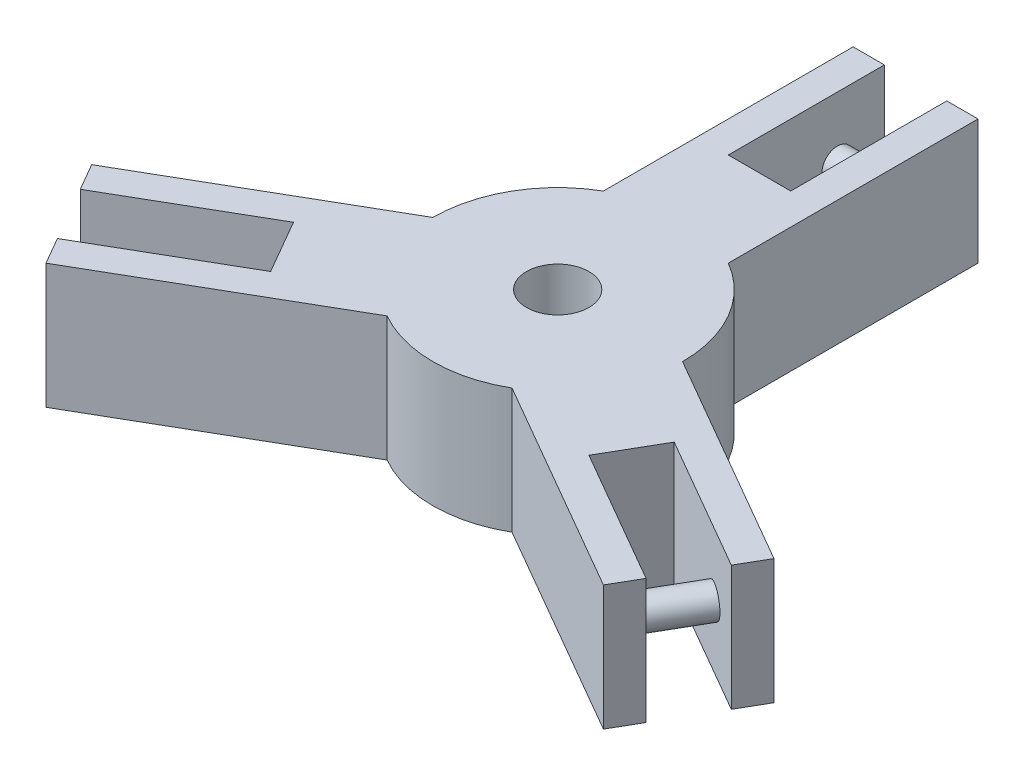
from build123d import *

# Parameters (mm, degrees)
SKETCH1_R           = 10
BOSS_EXTRUDE1_DEPTH = 40
SKETCH2_R           = 5
BOSS_EXTRUDE2_DEPTH = 25
CIRPATTERN1_COUNT   = 3


with BuildPart() as part:
    # Sketch1 → Boss-Extrude1 (new body)
    with BuildSketch(Plane(origin=(0, 0, 0), x_dir=(1, 0, 0), z_dir=(0, 1, 0))):
        with BuildLine():
            Line((-10, 114.641016151), (-20, 114.641016151))
            Line((-20, 114.641016151), (-20, 34.641016151))
            ThreePointArc((-20, 34.641016151), (-34.641016151, 20), (-40, 0))
            Line((-40, 0), (-109.282032303, -40))
            Line((-109.282032303, -40), (-104.282032303, -48.660254038))
            Line((-104.282032303, -48.660254038), (-60.980762114, -23.660254038))
            Line((-60.980762114, -23.660254038), (-50.980762114, -40.980762114))
            Line((-50.980762114, -40.980762114), (-94.282032303, -65.980762114))
            Line((-94.282032303, -65.980762114), (-89.282032303, -74.641016151))
            Line((-89.282032303, -74.641016151), (-20, -34.641016151))
            ThreePointArc((-20, -34.641016151), (0, -40), (20, -34.641016151))
            Line((20, -34.641016151), (89.282032303, -74.641016151))
            Line((89.282032303, -74.641016151), (94.282032303, -65.980762114))
            Line((94.282032303, -65.980762114), (50.980762114, -40.980762114))
            Line((50.980762114, -40.980762114), (60.980762114, -23.660254038))
            Line((60.980762114, -23.660254038), (104.282032303, -48.660254038))
            Line((104.282032303, -48.660254038), (109.282032303, -40))
            Line((109.282032303, -40), (40, 0))
            ThreePointArc((40, 0), (34.641016151, 20), (20, 34.641016151))
            Line((20, 34.641016151), (20, 114.641016151))
            Line((20, 114.641016151), (10, 114.641016151))
            Line((10, 114.641016151), (10, 64.641016151))
            Line((10, 64.641016151), (-10, 64.641016151))
            Line((-10, 64.641016151), (-10, 114.641016151))
        make_face()
        Circle(SKETCH1_R, mode=Mode.SUBTRACT)
    extrude(amount=BOSS_EXTRUDE1_DEPTH)

    # Sketch2 → Boss-Extrude2 (add)
    with BuildSketch(Plane(origin=(-10, 0, 0), x_dir=(0, 0, -1), z_dir=(1, 0, 0))):
        with Locations((99.641016151, 20)):
            Circle(SKETCH2_R)
    boss_extrude2 = extrude(amount=BOSS_EXTRUDE2_DEPTH)

    # CirPattern1: Boss-Extrude2 ×3 about axis
    cirpattern1_axis = Axis((0, 40, 0), (0, 1, 0))
    for i in range(1, CIRPATTERN1_COUNT):
        add(boss_extrude2.rotate(cirpattern1_axis, i * 360 / CIRPATTERN1_COUNT))


solid = part.part
